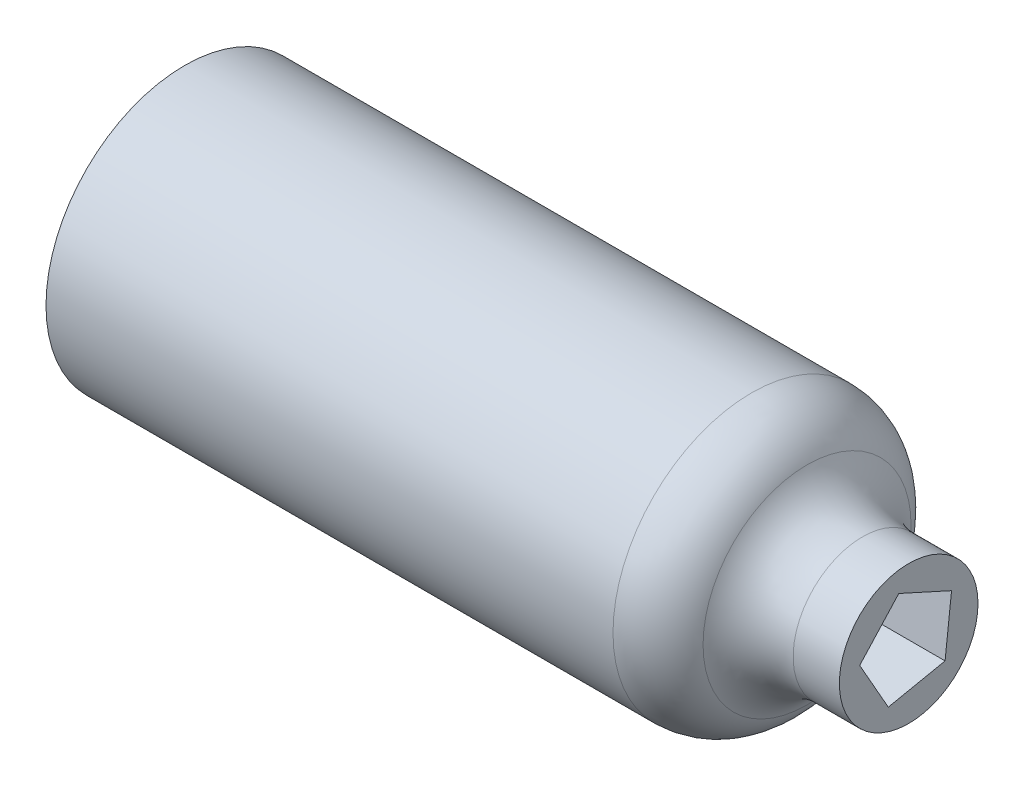
from build123d import *

# Parameters (mm, degrees)
SKETCH1_R           = 4.5
BOSS_EXTRUDE1_DEPTH = 16
SKETCH2_R           = 4.5
BOSS_EXTRUDE2_DEPTH = 4
SKETCH3_R           = 2.25
BOSS_EXTRUDE3_DEPTH = 3.5
FILLET1_R           = 2
FILLET2_R           = 2


with BuildPart() as part:
    # Sketch1 → Boss-Extrude1 (new body)
    with BuildSketch(Plane.YZ):
        Circle(SKETCH1_R)
        with BuildLine():
            Line((-1.747140521, 2.5), (1.747140521, 2.5))
            ThreePointArc((1.747140521, 2.5), (0, -3.05), (-1.747140521, 2.5))
        make_face(mode=Mode.SUBTRACT)
    extrude(amount=BOSS_EXTRUDE1_DEPTH)

    # Sketch2 → Boss-Extrude2 (add)
    with BuildSketch(Plane.YZ.offset(16)):
        Circle(SKETCH2_R)
    extrude(amount=BOSS_EXTRUDE2_DEPTH)

    # Sketch3 → Boss-Extrude3 (add)
    with BuildSketch(Plane.YZ.offset(20)):
        Circle(SKETCH3_R)
        Polygon((1.567343426, 0.321612476), (0.178464113, 1.590015899), (-1.457046538, 0.661071392), (-1.078968397, -1.18145131), (0.790207396, -1.391248458), align=None, mode=Mode.SUBTRACT)
    extrude(amount=BOSS_EXTRUDE3_DEPTH)

    # Fillet1
    fillet1_edges = [part.edges().sort_by_distance(p)[0] for p in [
        (20, -2.25, 0),
    ]]
    fillet(fillet1_edges, radius=FILLET1_R)

    # Fillet2
    fillet2_edges = [part.edges().sort_by_distance(p)[0] for p in [
        (20, -4.5, 0),
    ]]
    fillet(fillet2_edges, radius=FILLET2_R)


solid = part.part
